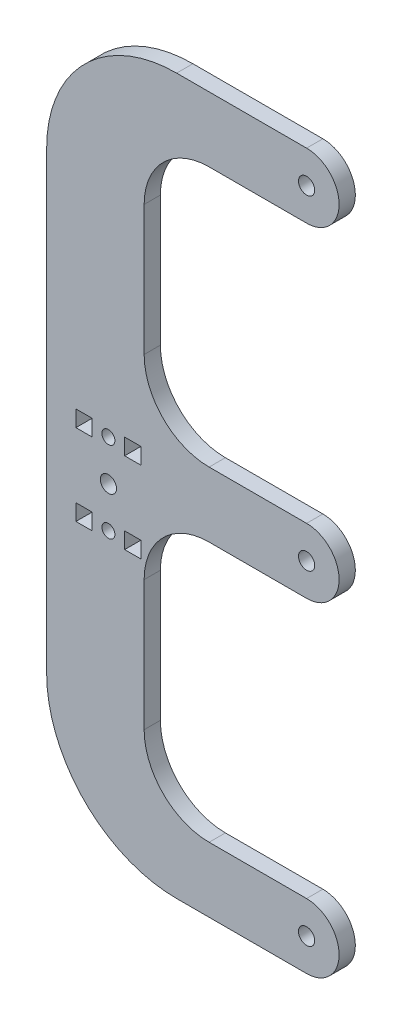
from build123d import *

# Parameters (mm, degrees)
BOSS_EXTRU_1_OUTLINE_W   = 5
BOSS_EXTRU_1_OUTLINE_H   = 5
BOSS_EXTRU_1_OUTLINE_R   = 2
BOSS_EXTRU_1_OUTLINE_R_2 = 2.5
BOSS_EXTRU_1_DEPTH       = 5
CONG_1_R                 = 20
CONG_2_R                 = 40


# Read off the part's stored shape, not the designer's step: Boss.-Extru.1
with BuildPart() as part:
    # Boss.-Extru.1 outline → Boss.-Extru.1 (new body)
    with BuildSketch(Plane.XY):
        with BuildLine():
            Line((10, 10), (10, 90))
            Line((10, 90), (60, 90))
            ThreePointArc((60, 90), (70, 100), (60, 110))
            Line((60, 110), (10, 110))
            Line((10, 110), (10, 190))
            Line((10, 190), (60, 190))
            ThreePointArc((60, 190), (70, 200), (60, 210))
            Line((60, 210), (-20, 210))
            Line((-20, 210), (-20, -10))
            Line((-20, -10), (60, -10))
            ThreePointArc((60, -10), (70, 0), (60, 10))
            Line((60, 10), (10, 10))
        make_face()
        with Locations((-8.5, 77.5)):
            Rectangle(BOSS_EXTRU_1_OUTLINE_W, BOSS_EXTRU_1_OUTLINE_H, mode=Mode.SUBTRACT)
        with Locations((-1, 77.5)):
            Circle(BOSS_EXTRU_1_OUTLINE_R, mode=Mode.SUBTRACT)
        with Locations((-1, 90)):
            Circle(BOSS_EXTRU_1_OUTLINE_R_2, mode=Mode.SUBTRACT)
        with Locations((6.5, 77.5)):
            Rectangle(BOSS_EXTRU_1_OUTLINE_W, BOSS_EXTRU_1_OUTLINE_H, mode=Mode.SUBTRACT)
        with Locations((60, 0)):
            Circle(BOSS_EXTRU_1_OUTLINE_R_2, mode=Mode.SUBTRACT)
        with Locations((-8.5, 102.5)):
            Rectangle(BOSS_EXTRU_1_OUTLINE_W, BOSS_EXTRU_1_OUTLINE_H, mode=Mode.SUBTRACT)
        with Locations((-1, 102.5)):
            Circle(BOSS_EXTRU_1_OUTLINE_R, mode=Mode.SUBTRACT)
        with Locations((6.5, 102.5)):
            Rectangle(BOSS_EXTRU_1_OUTLINE_W, BOSS_EXTRU_1_OUTLINE_H, mode=Mode.SUBTRACT)
        with Locations((60, 100)):
            Circle(BOSS_EXTRU_1_OUTLINE_R_2, mode=Mode.SUBTRACT)
        with Locations((60, 200)):
            Circle(BOSS_EXTRU_1_OUTLINE_R_2, mode=Mode.SUBTRACT)
    extrude(amount=BOSS_EXTRU_1_DEPTH)

    # Congé1
    cong_1_edges = [part.edges().sort_by_distance(p)[0] for p in [
        (10, 10, 2.5),
        (10, 190, 2.5),
        (10, 110, 2.5),
        (10, 90, 2.5),
    ]]
    fillet(cong_1_edges, radius=CONG_1_R)

    # Congé2
    cong_2_edges = [part.edges().sort_by_distance(p)[0] for p in [
        (-20, -10, 2.5),
        (-20, 210, 2.5),
    ]]
    fillet(cong_2_edges, radius=CONG_2_R)


solid = part.part
